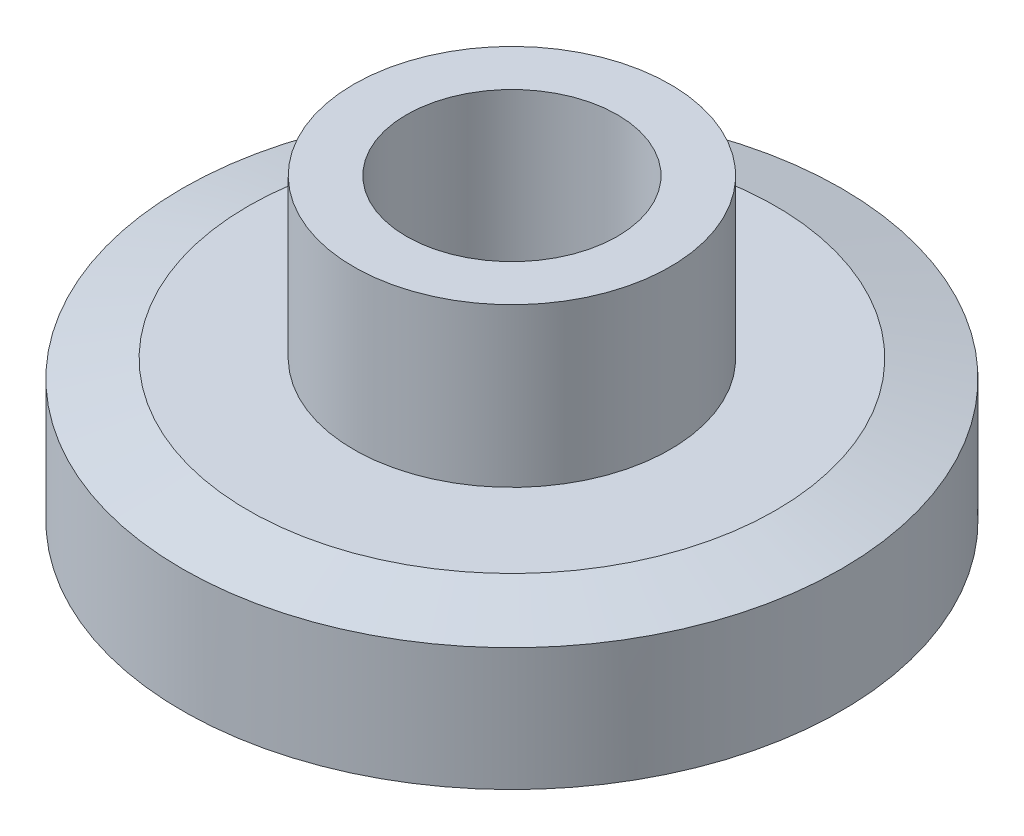
from build123d import *

# Parameters (mm, degrees)
CHAMFER_2_SIZE           = 1.25
CHAMFER_2_SIZE2          = 0.334936491
CHAMFER_3_SIZE           = 1.25
CHAMFER_3_SIZE2          = 0.334936491
CUT_EXTRUDE_2_DEPTH      = 11.68293031
CUT_EXTRUDE_2_DEPTH_BACK = 11.68293031
SKETCH_4_R               = 2


with BuildPart() as part:
    # Эскиз2 → Повернуть2 (revolve)
    with BuildSketch(Plane.XY):
        Polygon((0, 0), (6.25, 0), (6.25, 3), (3, 3), (3, 6), (0, 6), align=None)
    revolve(axis=Axis((0, 6, 0), (0, -1, 0)))

    # Фаска2
    chamfer_2_edges = [part.edges().sort_by_distance(p)[0] for p in [
        (-6.25, 3, 0),
    ]]
    chamfer_2_side = [part.faces().sort_by_distance(p)[0] for p in [
        (-6.073223305, 3, 0),
    ]]
    chamfer(chamfer_2_edges, length=CHAMFER_2_SIZE, length2=CHAMFER_2_SIZE2, reference=chamfer_2_side[0])

    # Фаска3
    chamfer_3_edges = [part.edges().sort_by_distance(p)[0] for p in [
        (-6.25, 0, 0),
    ]]
    chamfer_3_side = [part.faces().sort_by_distance(p)[0] for p in [
        (0, 0, 0),
    ]]
    chamfer(chamfer_3_edges, length=CHAMFER_3_SIZE, length2=CHAMFER_3_SIZE2, reference=chamfer_3_side[0])

    # Эскиз4 → Вырез-Вытянуть2 (cut, two sides: drawn at the far end of the back side and taken through both)
    with BuildSketch(Plane(origin=(0, 6, 0), x_dir=(1, 0, 0), z_dir=(0, 1, 0)).offset(-CUT_EXTRUDE_2_DEPTH_BACK)):
        Circle(SKETCH_4_R)
    extrude(amount=CUT_EXTRUDE_2_DEPTH + CUT_EXTRUDE_2_DEPTH_BACK, mode=Mode.SUBTRACT)


solid = part.part
